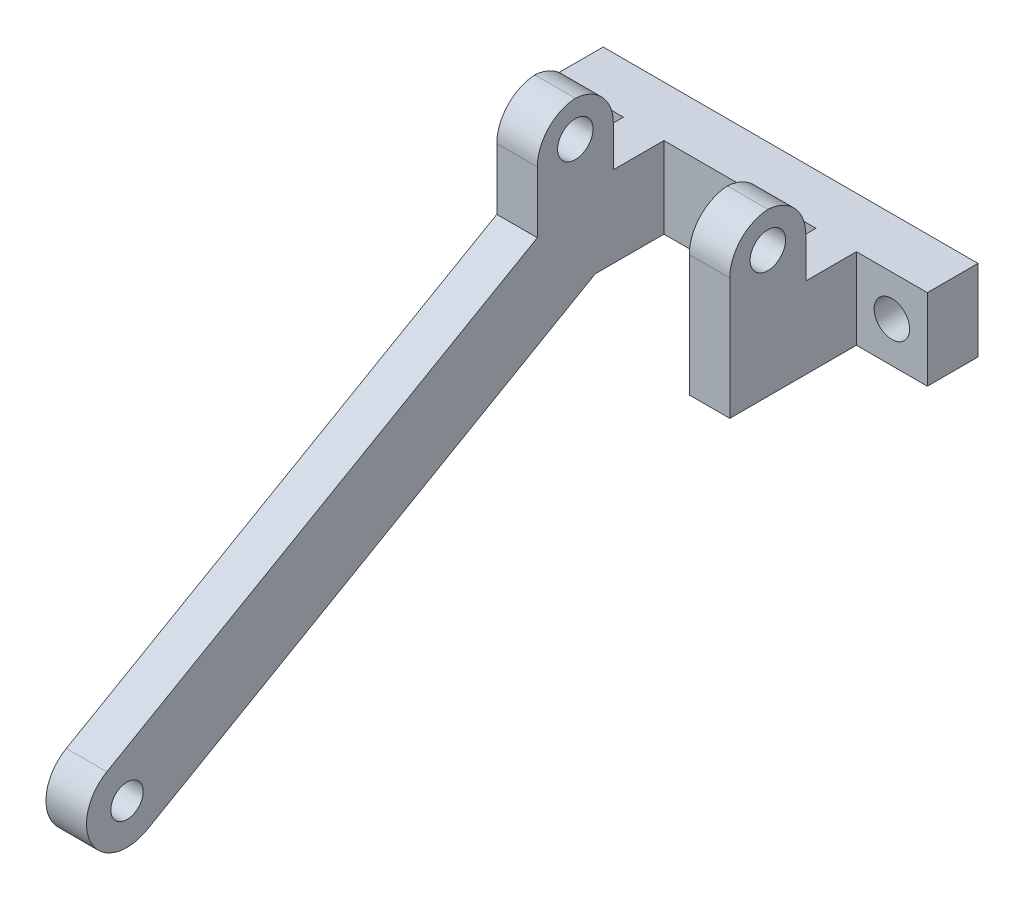
from build123d import *

# Parameters (mm, degrees)
SKETCH1_W           = 37
SKETCH1_H           = 8
SKETCH1_R           = 1.75
BOSS_EXTRUDE1_DEPTH = 5
SKETCH2_W           = 4
SKETCH2_H           = 8
BOSS_EXTRUDE2_DEPTH = 12.5
SKETCH4_W           = 4
SKETCH4_H           = 7.5
BOSS_EXTRUDE3_DEPTH = 8
SKETCH3_R           = 1.75
CUT_EXTRUDE1_DEPTH  = 37.745748053
FILLET1_R           = 4
SKETCH6_R           = 1.6
BOSS_EXTRUDE5_DEPTH = 4


with BuildPart() as part:
    # Sketch1 → Boss-Extrude1 (new body)
    with BuildSketch(Plane.XY):
        Rectangle(SKETCH1_W, SKETCH1_H)
        with Locations((-15, 0)):
            Circle(SKETCH1_R, mode=Mode.SUBTRACT)
        with Locations(Location((15, 0, 0), (0, 0, 180))):
            Circle(SKETCH1_R, mode=Mode.SUBTRACT)
    extrude(amount=BOSS_EXTRUDE1_DEPTH)

    # Sketch2 → Boss-Extrude2 (add)
    with BuildSketch(Plane.XY.offset(5)):
        with Locations((-9.5, 0)):
            Rectangle(SKETCH2_W, SKETCH2_H)
        with Locations((9.5, 0)):
            Rectangle(SKETCH2_W, SKETCH2_H)
    extrude(amount=BOSS_EXTRUDE2_DEPTH)

    # Sketch4 → Boss-Extrude3 (add)
    with BuildSketch(Plane(origin=(0, 4, 0), x_dir=(1, 0, 0), z_dir=(0, 1, 0))):
        with Locations((-9.5, -13.75)):
            Rectangle(SKETCH4_W, SKETCH4_H)
        with Locations((9.5, -13.75)):
            Rectangle(SKETCH4_W, SKETCH4_H)
    extrude(amount=BOSS_EXTRUDE3_DEPTH)

    # Sketch3 → Cut-Extrude1 (cut, through all)
    with BuildSketch(Plane.ZY.offset(11.5)):
        with Locations(Location((13.75, 8.5, 0), (0, 0, 270))):
            Circle(SKETCH3_R)
    extrude(amount=-CUT_EXTRUDE1_DEPTH, mode=Mode.SUBTRACT)

    # Fillet1
    # the kernel refuses this fillet: 4 mm, written as the material it takes off along each edge
    with BuildSketch(Plane(origin=(2.5, 12, 10), x_dir=(0, -1, 0), z_dir=(-1, 0, 0))) as fillet1_piece_1:
        with BuildLine():
            CenterArc((FILLET1_R, FILLET1_R), FILLET1_R, 180, 90)
            Line((0, FILLET1_R), (0, 0))
            Line((0, 0), (FILLET1_R, 0))
        make_face()
    extrude(amount=24, mode=Mode.SUBTRACT)
    with BuildSketch(Plane(origin=(-2.5, 12, 10), x_dir=(0, -1, 0), z_dir=(1, 0, 0)), Plane(origin=(21.5, 12, 17.5), x_dir=(0, -1, 0), z_dir=(-1, 0, 0)), Plane(origin=(-21.5, 12, 17.5), x_dir=(0, 0, -1), z_dir=(1, 0, 0))) as fillet1_piece_2:
        with BuildLine():
            CenterArc((FILLET1_R, -FILLET1_R), FILLET1_R, 90, 90)
            Line((0, -FILLET1_R), (0, 0))
            Line((0, 0), (FILLET1_R, 0))
        make_face()
    extrude(amount=24, mode=Mode.SUBTRACT)

    # Sketch6 → Boss-Extrude5 (add)
    with BuildSketch(Plane.ZY.offset(11.5)):
        with BuildLine():
            Line((56.011251263, -29.401227517), (11.782401197, -4))
            Line((11.782401197, -4), (17.5, 1.941786969))
            Line((17.5, 1.941786969), (59.995440826, -22.463920148))
            ThreePointArc((59.995440826, -22.463920148), (61.471999729, -27.924668614), (56.011251263, -29.401227517))
        make_face()
        with Locations(Location((58.003346044, -25.932573832, 0), (0, 0, 270))):
            Circle(SKETCH6_R, mode=Mode.SUBTRACT)
    extrude(amount=-BOSS_EXTRUDE5_DEPTH)


solid = part.part
